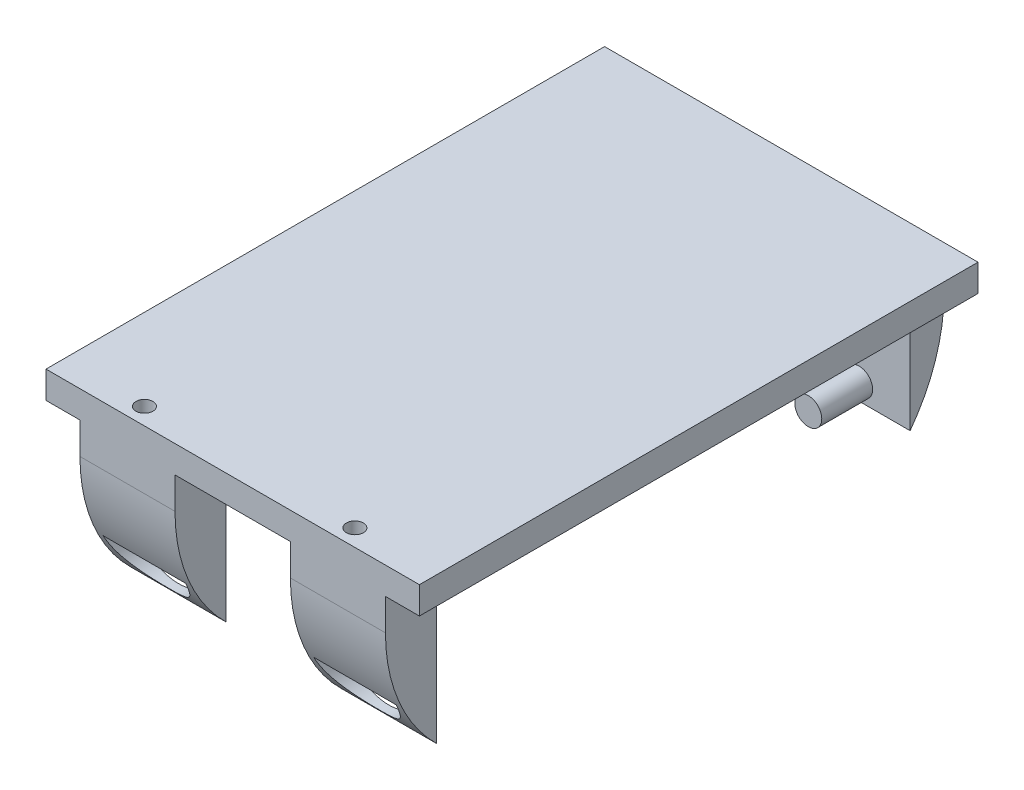
from build123d import *

# Parameters (mm, degrees)
SKETCH_1_W             = 110
SKETCH_1_H             = 8
EXTRUDE_1_DEPTH        = 164.55
SKETCH_7_W             = 28
SKETCH_7_H             = 15
EXTRUDE_2_DEPTH        = 45
FILLET_1_R             = 50
SKETCH_10_R            = 12.215
CUT_EXTRUDE_3_DEPTH    = 10
SKETCH_11_R            = 2.5
CUT_EXTRUDE_4_DEPTH    = 30
FILLET_1_OF_MIRROR_1_R = 50
SKETCH_13_W            = 28
SKETCH_13_H            = 10
EXTRUDE_3_DEPTH        = 35
FILLET_2_R             = 50
SKETCH_14_R            = 3.975
EXTRUDE_4_DEPTH        = 15
MIRROR_START           = -44.153846154
MIRROR_2_DEPTH         = 28
MIRROR_START_2         = 10
MIRROR_2_2_OUTLINE_R   = 3.975
MIRROR_2_2_DEPTH       = 15


with BuildPart() as part:
    # Эскиз1 → Бобышка-Вытянуть1 (new body)
    with BuildSketch(Plane.XY):
        with Locations((0.846153846, 10.153846154)):
            Rectangle(SKETCH_1_W, SKETCH_1_H)
    extrude(amount=EXTRUDE_1_DEPTH)

    # Эскиз7 → Бобышка-Вытянуть2 (add)
    with BuildSketch(Plane.XZ.offset(-6.153846154)):
        with Locations((31.846153846, 157.05)):
            Rectangle(SKETCH_7_W, SKETCH_7_H)
    extrude_2 = extrude(amount=EXTRUDE_2_DEPTH)

    # Скругление1
    # the kernel refuses this fillet: 50 mm, written as the material it takes off along each edge
    with BuildSketch(Plane(origin=(135.114009203, -38.846153846, 164.55), x_dir=(0, 1, 0), z_dir=(-1, 0, 0))) as fillet_1_piece_1:
        with BuildLine():
            CenterArc((35.707142143, 50), FILLET_1_R, 224.427004001, 45.572995999)
            Line((0, 15), (-0.714142843, 14.3))
            ThreePointArc((-0.714142843, 14.3), (-1, 7.5), (-1, 0))
            Line((-1, 0), (0, -1))
            Line((0, -1), (35.707142143, -1))
            Line((35.707142143, -1), (35.707142143, 0))
        make_face()
    extrude(amount=206.535710714, mode=Mode.SUBTRACT)

    # Эскиз10 → Вырез-Вытянуть3 (cut)
    with BuildSketch(Plane(origin=(0, 0, 149.55), x_dir=(-1, 0, 0), z_dir=(0, 0, -1))):
        with Locations((-31.846153846, -23.846153846)):
            Circle(SKETCH_10_R)
    cut_extrude_3 = extrude(amount=-CUT_EXTRUDE_3_DEPTH, mode=Mode.SUBTRACT)

    # Эскиз11 → Вырез-Вытянуть4 (cut)
    with BuildSketch(Plane(origin=(0, 14.153846154, 0), x_dir=(1, 0, 0), z_dir=(0, 1, 0))):
        with Locations(Location((31.846153846, -159.55, 0), (0, 0, 270))):
            Circle(SKETCH_11_R)
    cut_extrude_4 = extrude(amount=-CUT_EXTRUDE_4_DEPTH, mode=Mode.SUBTRACT)

    # Зеркальное отражение1: Бобышка-Вытянуть2, Вырез-Вытянуть3, Вырез-Вытянуть4 across plane
    add(extrude_2.mirror(Plane.ZY.offset(-0.846153846)))
    add(cut_extrude_3.mirror(Plane.ZY.offset(-0.846153846)), mode=Mode.SUBTRACT)
    add(cut_extrude_4.mirror(Plane.ZY.offset(-0.846153846)), mode=Mode.SUBTRACT)

    # Скругление1 of Зеркальное отражение1
    # the kernel refuses this fillet: 50 mm, written as the material it takes off along each edge
    with BuildSketch(Plane(origin=(-133.421701511, -38.846153846, 164.55), x_dir=(0, 1, 0), z_dir=(1, 0, 0))) as fillet_1_of_mirror_1_piece_1:
        with BuildLine():
            CenterArc((35.707142143, -50), FILLET_1_OF_MIRROR_1_R, 90, 45.572995999)
            Line((0, -15), (-0.714142843, -14.3))
            ThreePointArc((-0.714142843, -14.3), (-1, -7.5), (-1, 0))
            Line((-1, 0), (0, 1))
            Line((0, 1), (35.707142143, 1))
            Line((35.707142143, 1), (35.707142143, 0))
        make_face()
    extrude(amount=206.535710714, mode=Mode.SUBTRACT)

    # Эскиз13 → Бобышка-Вытянуть3 (add)
    with BuildSketch(Plane(origin=(0, 6.153846154, 0), x_dir=(-1, 0, 0), z_dir=(0, -1, 0))):
        with Locations((-31.846153846, -5)):
            Rectangle(SKETCH_13_W, SKETCH_13_H)
    extrude(amount=EXTRUDE_3_DEPTH)

    # Скругление2
    # the kernel refuses this fillet: 50 mm, written as the material it takes off along each edge
    with BuildSketch(Plane(origin=(-57.153846154, -28.846153846, 0), x_dir=(0, 1, 0), z_dir=(1, 0, 0))) as fillet_2_piece_1:
        with BuildLine():
            CenterArc((30, 50), FILLET_2_R, 233.130102354, 36.869897646)
            Line((0, 10), (0, 0))
            Line((0, 0), (30, 0))
        make_face()
    extrude(amount=178, mode=Mode.SUBTRACT)

    # Эскиз14 → Бобышка-Вытянуть4 (add)
    with BuildSketch(Plane.XY.offset(10)):
        with Locations(Location((30.846153846, -23.846153846, 0), (0, 0, 180))):
            Circle(SKETCH_14_R)
    extrude(amount=EXTRUDE_4_DEPTH)

    # Зеркальное отражение2: read off the stored shape, not the designer's step
    # Зеркальное отражение2 outline → Зеркальное отражение2 (add)
    with BuildSketch(Plane.YZ.offset(MIRROR_START)):
        with BuildLine():
            Line((1.153846154, 0), (6.153846154, 0))
            Line((6.153846154, 0), (6.153846154, 10))
            Line((6.153846154, 10), (-28.846153846, 10))
            ThreePointArc((-28.846153846, 10), (-14.657542147, 2.565835097), (1.153846154, 0))
        make_face()
    extrude(amount=MIRROR_2_DEPTH)

    # Mirror 2 2 outline → Mirror 2 2 (add)
    with BuildSketch(Plane.XY.offset(MIRROR_START_2)):
        with Locations((-29.153846154, -23.846153846)):
            Circle(MIRROR_2_2_OUTLINE_R)
    extrude(amount=MIRROR_2_2_DEPTH)


solid = part.part
